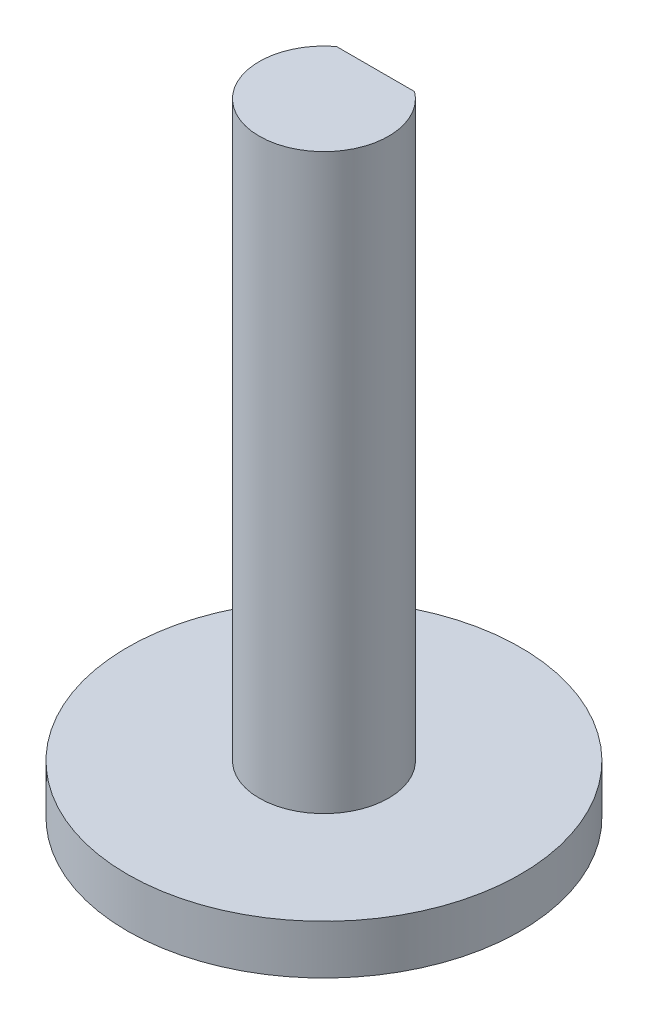
from build123d import *

# Parameters (mm, degrees)
CROQUIS3_R              = 12
SALIENTE_EXTRUIR1_DEPTH = 3
CROQUIS4_R              = 3.95
SALIENTE_EXTRUIR2_DEPTH = 35
CORTAR_EXTRUIR1_START   = -20
CORTAR_EXTRUIR1_DEPTH   = 20


with BuildPart() as part:
    # Croquis3 → Saliente-Extruir1 (new body)
    with BuildSketch(Plane(origin=(0, 0, 0), x_dir=(1, 0, 0), z_dir=(0, 1, 0))):
        Circle(CROQUIS3_R)
    extrude(amount=SALIENTE_EXTRUIR1_DEPTH)

    # Croquis4 → Saliente-Extruir2 (add)
    with BuildSketch(Plane(origin=(0, 3, 0), x_dir=(1, 0, 0), z_dir=(0, 1, 0))):
        Circle(CROQUIS4_R)
    extrude(amount=SALIENTE_EXTRUIR2_DEPTH)

    # Croquis5 → Cortar-Extruir1 (cut)
    with BuildSketch(Plane(origin=(0, 38, 0), x_dir=(1, 0, 0), z_dir=(0, 1, 0)).offset(CORTAR_EXTRUIR1_START)):
        with BuildLine():
            Line((2.383275058, 3.15), (-2.383275058, 3.15))
            ThreePointArc((-2.383275058, 3.15), (0, 3.95), (2.383275058, 3.15))
        make_face()
    extrude(amount=CORTAR_EXTRUIR1_DEPTH, mode=Mode.SUBTRACT)


solid = part.part
